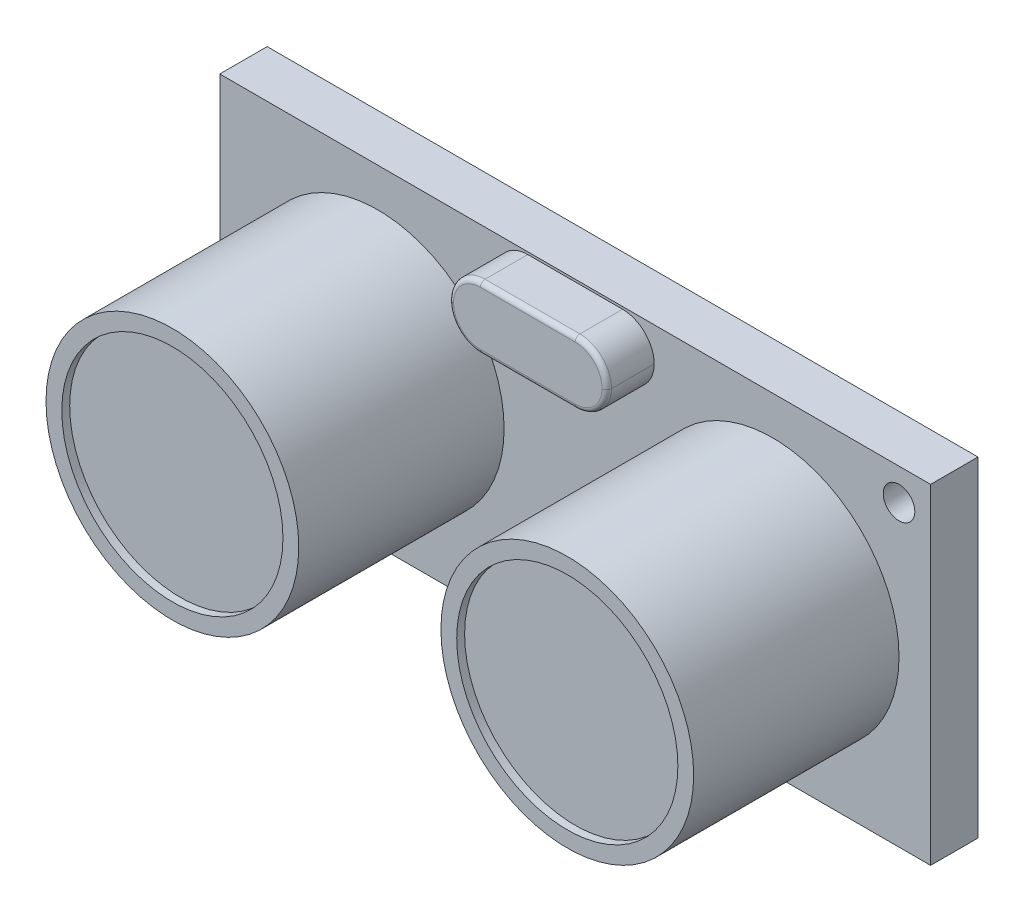
from build123d import *
from build123d.topology import SkipClean

# Parameters (mm, degrees)
SKETCH1_W                = 45
SKETCH1_H                = 20.89
SKETCH1_R                = 1
BOSS_EXTRUDE1_DEPTH      = 3
SKETCH2_R                = 8
BOSS_EXTRUDE2_DEPTH      = 13
SKETCH3_R                = 7
CUT_EXTRUDE1_DEPTH       = 0.5
EXTRUDE_THIN4_DEPTH      = 0.1
EXTRUDE_THIN4_DEPTH_BACK = 3.1
SKETCH4_R                = 1
SKETCH4_R_2              = 0.5
SKETCH13_R               = 0.5
CUT_EXTRUDE2_DEPTH       = 29.006214043
BOSS_EXTRUDE3_DEPTH      = 0.1
SKETCH15_W               = 10
SKETCH15_H               = 4
BOSS_EXTRUDE4_DEPTH      = 3
FILLET1_R                = 2
FILLET2_R                = 0.3


with BuildPart() as part:
    # Sketch1 → Boss-Extrude1 (new body)
    with BuildSketch(Plane.XY):
        Rectangle(SKETCH1_W, SKETCH1_H)
        with Locations((-20.5, -8.445)):
            Circle(SKETCH1_R, mode=Mode.SUBTRACT)
        with Locations((20.5, 8.445)):
            Circle(SKETCH1_R, mode=Mode.SUBTRACT)
    extrude(amount=BOSS_EXTRUDE1_DEPTH)

    # Sketch2 → Boss-Extrude2 (add)
    with BuildSketch(Plane.XY.offset(3)):
        with Locations(Location((-12.5, 0, 0), (0, 0, 180))):
            Circle(SKETCH2_R)
        with Locations(Location((12.5, 0, 0), (0, 0, 180))):
            Circle(SKETCH2_R)
    extrude(amount=BOSS_EXTRUDE2_DEPTH)

    # Sketch3 → Cut-Extrude1 (cut)
    with BuildSketch(Plane.XY.offset(16)):
        with Locations((-12.5, 0)):
            Circle(SKETCH3_R)
        with Locations((12.5, 0)):
            Circle(SKETCH3_R)
    extrude(amount=-CUT_EXTRUDE1_DEPTH, mode=Mode.SUBTRACT)

    # Sketch4 → Extrude-Thin4 (add, two sides: drawn at the far end of the back side and taken through both)
    # profile 1 of 5: a face of its own
    with BuildSketch(Plane.XY.offset(3).offset(-EXTRUDE_THIN4_DEPTH_BACK)):
        with Locations((-5.08, -8.406)):
            Circle(SKETCH4_R)
        with Locations((-5.08, -8.406)):
            Circle(SKETCH4_R_2, mode=Mode.SUBTRACT)
    # profile 2 of 5: a face of its own
    with BuildSketch(Plane.XY.offset(3).offset(-EXTRUDE_THIN4_DEPTH_BACK)):
        with Locations((-2.54, -8.406)):
            Circle(SKETCH4_R)
        with Locations((-2.54, -8.406)):
            Circle(SKETCH4_R_2, mode=Mode.SUBTRACT)
    # profile 3 of 5: a face of its own
    with BuildSketch(Plane.XY.offset(3).offset(-EXTRUDE_THIN4_DEPTH_BACK)):
        with Locations((0, -8.406)):
            Circle(SKETCH4_R)
        with Locations((0, -8.406)):
            Circle(SKETCH4_R_2, mode=Mode.SUBTRACT)
    # profile 4 of 5: a face of its own
    with BuildSketch(Plane.XY.offset(3).offset(-EXTRUDE_THIN4_DEPTH_BACK)):
        with Locations((2.54, -8.406)):
            Circle(SKETCH4_R)
        with Locations((2.54, -8.406)):
            Circle(SKETCH4_R_2, mode=Mode.SUBTRACT)
    # profile 5 of 5: a face of its own
    with BuildSketch(Plane.XY.offset(3).offset(-EXTRUDE_THIN4_DEPTH_BACK)):
        with Locations((5.08, -8.406)):
            Circle(SKETCH4_R)
        with Locations((5.08, -8.406)):
            Circle(SKETCH4_R_2, mode=Mode.SUBTRACT)
    extrude(amount=EXTRUDE_THIN4_DEPTH + EXTRUDE_THIN4_DEPTH_BACK)

    # Sketch13 → Cut-Extrude2 (cut, through all)
    with SkipClean():  # the faces are left unmerged after this step: merging them gives an invalid solid
        with BuildSketch(Plane.XY.offset(3)):
            with Locations((-5.08, -8.406)):
                Circle(SKETCH13_R)
            with Locations((-2.54, -8.406)):
                Circle(SKETCH13_R)
            with Locations(Location((0, -8.406, 0), (0, 0, 180))):
                Circle(SKETCH13_R)
            with Locations(Location((2.54, -8.406, 0), (0, 0, 180))):
                Circle(SKETCH13_R)
            with Locations(Location((5.08, -8.406, 0), (0, 0, 180))):
                Circle(SKETCH13_R)
        extrude(amount=-CUT_EXTRUDE2_DEPTH, mode=Mode.SUBTRACT)

    # Sketch12 → Boss-Extrude3 (add)
    # profile 1 of 5: a face of its own
    with SkipClean():  # the faces are left unmerged after this step: merging them gives an invalid solid
        with BuildSketch(Plane(origin=(0, 0, 0), x_dir=(-1, 0, 0), z_dir=(0, 0, -1))):
            with BuildLine():
                add(Edge.make_bspline(
                    [(19.46929145, -2.683893026), (19.484417806, -2.684223579), (19.51433311, -2.684877312), (19.55857677, -2.689412347), (19.601609877, -2.696623598), (19.643529262, -2.706555749), (19.684115837, -2.719918963), (19.723610749, -2.736127809), (19.762201128, -2.75474264), (19.799136653, -2.77713075), (19.834715807, -2.80169308), (19.86828259, -2.829333068), (19.900019773, -2.859416979), (19.929842776, -2.892296508), (19.95696226, -2.928352739), (19.982882923, -2.966466663), (20.006501357, -3.007561369), (20.028166536, -3.051214815), (20.047339104, -3.097375117), (20.064173328, -3.145621658), (20.078768602, -3.195935133), (20.090261272, -3.24837133), (20.099075501, -3.302915202), (20.10540034, -3.359565322), (20.109601073, -3.418341945), (20.109976956, -3.458260498), (20.110167222, -3.478466619)],
                    knots=[0, 0, 0, 0, 0.949010564, 1.876852617, 2.787529374, 3.685273709, 4.577074086, 5.465471387, 6.362587764, 7.262213343, 8.172580635, 9.073145362, 9.987411958, 10.914456489, 11.85451744, 12.815917507, 13.804911429, 14.825868585, 15.871774033, 16.938849417, 18.030625794, 19.156736427, 20.304747212, 21.4957645, 22.732396811, 24, 24, 24, 24], degree=3))
                add(Edge.make_bspline(
                    [(20.110167222, -3.478466619), (20.109713592, -3.502551257), (20.108822914, -3.54984022), (20.103860332, -3.619166231), (20.094377913, -3.685161229), (20.082197449, -3.748129578), (20.065811319, -3.807833441), (20.045507132, -3.864154145), (20.022642346, -3.91766615), (20.003613894, -3.950828686), (19.994191581, -3.967249769)],
                    knots=[0, 0, 0, 0, 1.136969792, 2.232382444, 3.278022597, 4.282276305, 5.258039159, 6.196692155, 7.1070566, 8, 8, 8, 8], degree=3))
                add(Edge.make_bspline(
                    [(19.994191581, -3.967249769), (19.980125855, -3.988503916), (19.952188373, -4.030719109), (19.900998849, -4.087338382), (19.843562074, -4.138033515), (19.780391, -4.18158225), (19.714579966, -4.217072851), (19.648412339, -4.243220973), (19.582822371, -4.259318087), (19.539200268, -4.261525811), (19.517848725, -4.262606417)],
                    knots=[0, 0, 0, 0, 1.048346287, 2.082235551, 3.132143771, 4.197203545, 5.234784445, 6.204564675, 7.121195205, 8, 8, 8, 8], degree=3))
                add(Edge.make_bspline(
                    [(19.517848725, -4.262606417), (19.505880841, -4.261996217), (19.482506815, -4.260804457), (19.448934686, -4.251239838), (19.418256579, -4.235582628), (19.390595856, -4.214519543), (19.367774744, -4.188124339), (19.351003002, -4.157808329), (19.340409896, -4.124045436), (19.339393406, -4.100293963), (19.338869017, -4.088041007)],
                    knots=[0, 0, 0, 0, 1.029346977, 2.010378973, 2.978887221, 3.98112847, 4.985683985, 5.960201932, 6.947705008, 8, 8, 8, 8], degree=3))
                add(Edge.make_bspline(
                    [(19.338869017, -4.088041007), (19.339245694, -4.078080516), (19.339975706, -4.058776797), (19.348168728, -4.031204492), (19.36058334, -4.005800586), (19.37898544, -3.982970809), (19.401999508, -3.962194269), (19.429956992, -3.943235584), (19.462379414, -3.925486113), (19.486424996, -3.91601565), (19.498987635, -3.911067797)],
                    knots=[0, 0, 0, 0, 0.932019786, 1.806281372, 2.676477655, 3.570524242, 4.53911087, 5.576821434, 6.734007876, 8, 8, 8, 8], degree=3))
                add(Edge.make_bspline(
                    [(19.498987635, -3.911067797), (19.514154901, -3.904497014), (19.543429775, -3.891814514), (19.585067298, -3.871507385), (19.622251922, -3.849696316), (19.656489949, -3.82744116), (19.687800087, -3.802502501), (19.714997365, -3.772135305), (19.740183391, -3.737971347), (19.761936387, -3.698509866), (19.780332925, -3.653726361), (19.792758911, -3.602341133), (19.800986198, -3.544947653), (19.801631627, -3.504449709), (19.80196898, -3.483282216)],
                    knots=[0, 0, 0, 0, 1.049630502, 2.025928848, 2.939419198, 3.785195675, 4.618337008, 5.47201057, 6.365697361, 7.308725407, 8.32613671, 9.430404736, 10.656922266, 12, 12, 12, 12], degree=3))
                add(Edge.make_bspline(
                    [(19.80196898, -3.483282216), (19.801786665, -3.468289639), (19.801429478, -3.438916536), (19.797209523, -3.39604058), (19.790984576, -3.355224522), (19.781715623, -3.316744761), (19.770034495, -3.280393465), (19.756022784, -3.246070232), (19.739234454, -3.213860117), (19.719531242, -3.184397308), (19.698330902, -3.157558433), (19.676051651, -3.13356403), (19.651734729, -3.113808265), (19.626201925, -3.097691901), (19.599724219, -3.084476637), (19.571616619, -3.075919648), (19.542461561, -3.069773451), (19.522430697, -3.06935428), (19.512230528, -3.069140828)],
                    knots=[0, 0, 0, 0, 1.280312405, 2.508357684, 3.676903495, 4.804965861, 5.885491899, 6.935930188, 7.96843881, 8.982636488, 9.958848435, 10.888398438, 11.773624114, 12.626391924, 13.464564268, 14.292153698, 15.130326042, 16, 16, 16, 16], degree=3))
                add(Edge.make_bspline(
                    [(19.512230528, -3.069140828), (19.496494601, -3.069862799), (19.466161185, -3.071254509), (19.423077099, -3.083358943), (19.384333744, -3.102661617), (19.351407073, -3.130916015), (19.322475421, -3.164394049), (19.297717898, -3.203046341), (19.27585837, -3.245712555), (19.257854232, -3.293840184), (19.241563213, -3.348197534), (19.224705921, -3.410023046), (19.207664422, -3.480218562), (19.196344494, -3.529818585), (19.190388093, -3.555917479)],
                    knots=[0, 0, 0, 0, 0.888922646, 1.713534847, 2.512522705, 3.3189352, 4.1507089, 5.009465297, 5.910012526, 6.858957344, 7.912524916, 9.120887575, 10.485048098, 12, 12, 12, 12], degree=3))
                add(Edge.make_bspline(
                    [(19.190388093, -3.555917479), (19.181929691, -3.590087259), (19.165660619, -3.655810153), (19.138396278, -3.749704133), (19.107487465, -3.834351038), (19.075996763, -3.911613713), (19.039365433, -3.980627007), (18.996986053, -4.042080143), (18.948115752, -4.095761163), (18.902393794, -4.13442943), (18.86273622, -4.160699668), (18.831410889, -4.178047101), (18.798259358, -4.192636269), (18.763245036, -4.204110897), (18.726634467, -4.213350814), (18.688309172, -4.220246185), (18.648186982, -4.224299229), (18.620819207, -4.224686994), (18.606898192, -4.224884237)],
                    knots=[0, 0, 0, 0, 1.736572963, 3.340162069, 4.820136415, 6.180570834, 7.453029487, 8.666721429, 9.853271306, 11.024342417, 11.610026699, 12.197789198, 12.78876586, 13.39394109, 14.013340947, 14.650211638, 15.313410593, 16, 16, 16, 16], degree=3))
                add(Edge.make_bspline(
                    [(18.606898192, -4.224884237), (18.593504819, -4.224740931), (18.567042485, -4.224457791), (18.527951434, -4.219539845), (18.489840843, -4.213216925), (18.453112282, -4.202724962), (18.417329584, -4.190475928), (18.382581113, -4.175232627), (18.349418394, -4.156536443), (18.317126027, -4.135826985), (18.286692517, -4.111986582), (18.25762662, -4.08581059), (18.230312173, -4.057111963), (18.205669793, -4.025320842), (18.181514952, -3.992245277), (18.160416695, -3.955702998), (18.14091815, -3.91689848), (18.11625726, -3.861474515), (18.091695675, -3.786346212), (18.070365196, -3.689863343), (18.058072069, -3.585795903), (18.056383732, -3.513947159), (18.055512274, -3.47686142)],
                    knots=[0, 0, 0, 0, 0.769461614, 1.520285473, 2.262551752, 2.988378485, 3.713226575, 4.436358852, 5.166208618, 5.900059362, 6.640050888, 7.38609301, 8.147789305, 8.914131076, 9.697346069, 10.500657756, 11.336485078, 12.193936862, 13.986438256, 15.869279717, 17.867870641, 20, 20, 20, 20], degree=3))
                add(Edge.make_bspline(
                    [(18.055512274, -3.47686142), (18.05600825, -3.447276945), (18.056966469, -3.390120075), (18.065519679, -3.307472284), (18.079250927, -3.231021329), (18.098946205, -3.160799164), (18.123752788, -3.096740742), (18.151543955, -3.038011171), (18.183353447, -2.98499297), (18.218799743, -2.938098441), (18.256208591, -2.896738524), (18.29544728, -2.86187447), (18.334774717, -2.831879), (18.375544801, -2.808851006), (18.416194468, -2.790441669), (18.45663055, -2.777736893), (18.496605537, -2.769471846), (18.523121397, -2.768598858), (18.536269428, -2.768165983)],
                    knots=[0, 0, 0, 0, 1.50180492, 2.901470176, 4.213680385, 5.441471803, 6.598163128, 7.697894763, 8.73692932, 9.731292389, 10.678417777, 11.563424905, 12.393422888, 13.184490135, 13.9355001, 14.655109254, 15.333128709, 16, 16, 16, 16], degree=3))
                add(Edge.make_bspline(
                    [(18.536269428, -2.768165983), (18.547968876, -2.768793298), (18.571072832, -2.770032115), (18.604767094, -2.779696382), (18.636323295, -2.79565456), (18.665371842, -2.817096846), (18.690072435, -2.843185233), (18.708902898, -2.872979724), (18.719626181, -2.906578955), (18.72097737, -2.929949853), (18.721669933, -2.941928794)],
                    knots=[0, 0, 0, 0, 0.996524447, 1.967926831, 2.962621832, 3.998325838, 5.031199617, 6.009342139, 6.979672482, 8, 8, 8, 8], degree=3))
                add(Edge.make_bspline(
                    [(18.721669933, -2.941928794), (18.721237923, -2.952509599), (18.720422718, -2.97247568), (18.71565128, -3.000753797), (18.705808035, -3.024736317), (18.692326163, -3.045597334), (18.674096087, -3.06379414), (18.652013526, -3.082466258), (18.625325748, -3.101924205), (18.605379739, -3.114352949), (18.594859198, -3.120908502)],
                    knots=[0, 0, 0, 0, 1.091037725, 2.058798536, 2.936702634, 3.743333543, 4.601209271, 5.578930148, 6.723004324, 8, 8, 8, 8], degree=3))
                add(Edge.make_bspline(
                    [(18.594859198, -3.120908502), (18.575539247, -3.130312653), (18.538259559, -3.14845886), (18.487226134, -3.180663145), (18.443363111, -3.216252044), (18.411121732, -3.248091479), (18.388932809, -3.276172478), (18.375392396, -3.300675856), (18.36395225, -3.327916675), (18.354092471, -3.357915788), (18.347112663, -3.391039717), (18.341977684, -3.42710389), (18.338748427, -3.466102827), (18.338272979, -3.493040834), (18.338027329, -3.506958904)],
                    knots=[0, 0, 0, 0, 1.547925219, 2.986869477, 4.337480217, 5.612327564, 6.244828973, 6.909713596, 7.622436063, 8.372459485, 9.181850378, 10.058552105, 10.996911345, 12, 12, 12, 12], degree=3))
                add(Edge.make_bspline(
                    [(18.338027329, -3.506958904), (18.338865045, -3.532558407), (18.340463722, -3.581411873), (18.352743768, -3.651016511), (18.374037305, -3.712842943), (18.398984211, -3.758442548), (18.422788372, -3.789499691), (18.44081972, -3.810017039), (18.460169787, -3.826920103), (18.480431517, -3.840723538), (18.501450251, -3.851609225), (18.523287707, -3.860004514), (18.546272099, -3.86424575), (18.561805072, -3.864961487), (18.569577311, -3.865319621)],
                    knots=[0, 0, 0, 0, 1.953936482, 3.728844638, 5.372901677, 6.927342473, 7.670868145, 8.357884895, 9.009286022, 9.626820382, 10.225224998, 10.813344112, 11.406232554, 12, 12, 12, 12], degree=3))
                add(Edge.make_bspline(
                    [(18.569577311, -3.865319621), (18.579113211, -3.864980933), (18.597877953, -3.864314463), (18.624868169, -3.857681525), (18.649829947, -3.847135242), (18.67264924, -3.832338988), (18.693462973, -3.81368373), (18.712613766, -3.79174254), (18.73098022, -3.767342768), (18.751816257, -3.730051612), (18.774805884, -3.681539116), (18.791979424, -3.629173216), (18.805454941, -3.582429304), (18.816688397, -3.537433055), (18.831039039, -3.483002716), (18.840542262, -3.443308216), (18.845671569, -3.421883348)],
                    knots=[0, 0, 0, 0, 0.710597064, 1.398312741, 2.060329599, 2.724976052, 3.418105476, 4.139422309, 4.896209246, 5.692466705, 7.322744487, 8.895039973, 9.798770174, 10.953818098, 12.355841563, 14, 14, 14, 14], degree=3))
                add(Edge.make_bspline(
                    [(18.845671569, -3.421883348), (18.852243438, -3.39456596), (18.865099634, -3.341126413), (18.885959774, -3.263074468), (18.907992459, -3.189099277), (18.93074843, -3.118931762), (18.955043623, -3.053188778), (18.983131163, -2.992870483), (19.012545732, -2.937168657), (19.045060109, -2.886506913), (19.081514481, -2.841201333), (19.121641686, -2.800461623), (19.167070347, -2.766064391), (19.216582316, -2.736142614), (19.271527657, -2.71228591), (19.332434707, -2.695591819), (19.3989918, -2.685475813), (19.445309679, -2.684432972), (19.46929145, -2.683893026)],
                    knots=[0, 0, 0, 0, 1.267425996, 2.479397737, 3.644026965, 4.748891262, 5.806868875, 6.803181051, 7.748078724, 8.646880768, 9.513885508, 10.367259778, 11.219353025, 12.077259478, 12.971817986, 13.911770136, 14.918787934, 16, 16, 16, 16], degree=3))
            make_face()
        # profile 2 of 5: a face of its own
        with BuildSketch(Plane(origin=(0, 0, 0), x_dir=(-1, 0, 0), z_dir=(0, 0, -1))):
            with BuildLine():
                Line((19.236938869, -1.800230878), (19.236938869, -1.939080607))
                Line((19.236938869, -1.939080607), (19.867782146, -1.939080607))
                add(Edge.make_bspline(
                    [(19.867782146, -1.939080607), (19.887227731, -1.939569463), (19.923611489, -1.940484139), (19.974280577, -1.950401281), (20.017014821, -1.967090735), (20.051586482, -1.990674356), (20.077777649, -2.01990028), (20.096740238, -2.053243428), (20.108349006, -2.090822708), (20.10955054, -2.117308302), (20.110167222, -2.130901909)],
                    knots=[0, 0, 0, 0, 1.331902197, 2.492062242, 3.520752585, 4.456973203, 5.333663409, 6.188000262, 7.069999586, 8, 8, 8, 8], degree=3))
                add(Edge.make_bspline(
                    [(20.110167222, -2.130901909), (20.109373291, -2.145409776), (20.107847372, -2.173293636), (20.09683532, -2.212967924), (20.076205729, -2.24664497), (20.048918398, -2.275511003), (20.013410064, -2.297766017), (19.970726045, -2.313122177), (19.921183627, -2.322818647), (19.88575683, -2.3238054), (19.866979546, -2.32432841)],
                    knots=[0, 0, 0, 0, 0.98758274, 1.898116353, 2.767902367, 3.650180778, 4.579683533, 5.591031871, 6.723173417, 8, 8, 8, 8], degree=3))
                Line((19.866979546, -2.32432841), (18.351270222, -2.32432841))
                add(Edge.make_bspline(
                    [(18.351270222, -2.32432841), (18.331280944, -2.323740288), (18.293773724, -2.322636755), (18.24188352, -2.311937018), (18.198309786, -2.294538775), (18.163257167, -2.268807182), (18.137095477, -2.234173002), (18.11923, -2.191152639), (18.108558909, -2.139709432), (18.107464294, -2.102600256), (18.106878648, -2.082745934)],
                    knots=[0, 0, 0, 0, 1.204539147, 2.260157444, 3.178834964, 4.014831347, 4.849268471, 5.763683293, 6.803515522, 8, 8, 8, 8], degree=3))
                Line((18.106878648, -2.082745934), (18.106878648, -1.442271461))
                add(Edge.make_bspline(
                    [(18.106878648, -1.442271461), (18.107059476, -1.42100132), (18.107407569, -1.380056515), (18.109303723, -1.320900151), (18.112849589, -1.266553391), (18.117921188, -1.216426566), (18.125407338, -1.169982505), (18.136034656, -1.126315058), (18.148886368, -1.084761869), (18.160527911, -1.058662721), (18.166271017, -1.045787265)],
                    knots=[0, 0, 0, 0, 1.263018195, 2.431297115, 3.513891869, 4.496307935, 5.422122339, 6.30446181, 7.163542459, 8, 8, 8, 8], degree=3))
                add(Edge.make_bspline(
                    [(18.166271017, -1.045787265), (18.173186513, -1.030381203), (18.186937288, -0.999747782), (18.213068639, -0.956540312), (18.243033035, -0.915964655), (18.27740064, -0.878682035), (18.314738259, -0.844403579), (18.35614933, -0.815189152), (18.399953527, -0.789676869), (18.44667819, -0.768825651), (18.495523638, -0.752581195), (18.54592107, -0.740211327), (18.597885926, -0.73347835), (18.632965113, -0.732475909), (18.650639869, -0.731970825)],
                    knots=[0, 0, 0, 0, 0.991101386, 1.970706541, 2.959125982, 3.949043219, 4.94477413, 5.930285116, 6.919453739, 7.918248778, 8.929482208, 9.939493973, 10.961807665, 12, 12, 12, 12], degree=3))
                add(Edge.make_bspline(
                    [(18.650639869, -0.731970825), (18.668583461, -0.73232809), (18.703639593, -0.733026073), (18.754754471, -0.73928432), (18.803248931, -0.748815301), (18.849139587, -0.762180424), (18.891914834, -0.780678697), (18.932132977, -0.802137642), (18.96957958, -0.827786237), (19.004173954, -0.857528021), (19.035791681, -0.89170093), (19.065916222, -0.928992469), (19.092585043, -0.97108369), (19.11714069, -1.016954235), (19.139142453, -1.067082964), (19.159163306, -1.121022773), (19.176521958, -1.179220962), (19.185676642, -1.219624181), (19.190388093, -1.240417665)],
                    knots=[0, 0, 0, 0, 1.05507517, 2.061284822, 3.02416977, 3.960190338, 4.866266322, 5.760478336, 6.637811303, 7.530498893, 8.437803919, 9.372931164, 10.346335214, 11.363650695, 12.430976955, 13.56370004, 14.746160234, 16, 16, 16, 16], degree=3))
                add(Edge.make_bspline(
                    [(19.190388093, -1.240417665), (19.200427827, -1.222376106), (19.220899361, -1.185588436), (19.259959389, -1.133796289), (19.304747277, -1.08278582), (19.356254388, -1.033986697), (19.411591028, -0.986799902), (19.469225772, -0.941636778), (19.528332151, -0.898760059), (19.588907267, -0.859624919), (19.648670628, -0.823618677), (19.706099342, -0.791258715), (19.760703138, -0.763640398), (19.811402894, -0.740153767), (19.856655487, -0.721449354), (19.894955835, -0.708122709), (19.925318671, -0.699169475), (19.94332506, -0.697397202), (19.950851203, -0.696656443)],
                    knots=[0, 0, 0, 0, 1.035092047, 2.110606056, 3.247378518, 4.439119437, 5.667527541, 6.896357491, 8.113024158, 9.330801598, 10.514364801, 11.614385948, 12.638182879, 13.584379214, 14.418398752, 15.093545921, 15.621128711, 16, 16, 16, 16], degree=3))
                add(Edge.make_bspline(
                    [(19.950851203, -0.696656443), (19.964041869, -0.697988111), (19.991453629, -0.700755473), (20.022873295, -0.717654824), (20.046183068, -0.73517527), (20.062660295, -0.75101425), (20.076500599, -0.769624107), (20.088663848, -0.79012526), (20.098335005, -0.812632242), (20.105021051, -0.837084422), (20.109741287, -0.863148392), (20.110023058, -0.881232034), (20.110167222, -0.890484244)],
                    knots=[0, 0, 0, 0, 1.421053962, 2.95311776, 3.768369014, 4.575895034, 5.411397774, 6.266672613, 7.147343469, 8.048766422, 9.001682164, 10, 10, 10, 10], degree=3))
                add(Edge.make_bspline(
                    [(20.110167222, -0.890484244), (20.109832205, -0.901356962), (20.109185491, -0.922345541), (20.10279153, -0.952381058), (20.093565654, -0.980199809), (20.074127778, -1.012575278), (20.044129385, -1.049196215), (20.006138096, -1.079661725), (19.970415066, -1.103157313), (19.937742869, -1.124120877), (19.899373952, -1.148105272), (19.871683967, -1.164876217), (19.856947051, -1.173801899)],
                    knots=[0, 0, 0, 0, 0.812054064, 1.56758039, 2.289145878, 2.992867892, 4.379130512, 5.807652158, 6.615255223, 7.578411575, 8.711203985, 10, 10, 10, 10], degree=3))
                Line((19.856947051, -1.173801899), (19.591687887, -1.335124416))
                add(Edge.make_bspline(
                    [(19.591687887, -1.335124416), (19.568712309, -1.348871396), (19.525264039, -1.374867804), (19.465196917, -1.414237897), (19.413821081, -1.45135698), (19.370496318, -1.486425891), (19.334807335, -1.520807514), (19.305094614, -1.55469524), (19.282105713, -1.589560527), (19.264098857, -1.62500043), (19.25142667, -1.663012017), (19.243523551, -1.704868082), (19.237482435, -1.750965884), (19.237125087, -1.783353374), (19.236938869, -1.800230878)],
                    knots=[0, 0, 0, 0, 1.549240544, 2.929711722, 4.154429701, 5.215920692, 6.152032193, 7.019334908, 7.817977517, 8.562251951, 9.313736963, 10.127430344, 11.024181782, 12, 12, 12, 12], degree=3))
            make_face()
            with BuildLine():
                Line((18.41507689, -1.573095194), (18.41507689, -1.939080607))
                Line((18.41507689, -1.939080607), (18.954423814, -1.939080607))
                Line((18.954423814, -1.939080607), (18.954423814, -1.583930289))
                add(Edge.make_bspline(
                    [(18.954423814, -1.583930289), (18.954079771, -1.561052235), (18.95341716, -1.516990022), (18.949415073, -1.453810733), (18.941134359, -1.396364754), (18.930772368, -1.34454499), (18.916521718, -1.298160403), (18.897635038, -1.257536318), (18.874321584, -1.222486007), (18.846171277, -1.193339399), (18.812927068, -1.170191533), (18.773918643, -1.154204272), (18.729500531, -1.144486988), (18.698046819, -1.143447393), (18.681539953, -1.142901815)],
                    knots=[0, 0, 0, 0, 1.392674693, 2.682235545, 3.849820756, 4.922907172, 5.896284646, 6.795937237, 7.640517491, 8.44662346, 9.24840026, 10.087665541, 10.996409465, 12, 12, 12, 12], degree=3))
                add(Edge.make_bspline(
                    [(18.681539953, -1.142901815), (18.668249815, -1.143268512), (18.642212955, -1.143986913), (18.604681271, -1.152433954), (18.569452481, -1.16532031), (18.537115649, -1.183502086), (18.507412206, -1.205750853), (18.482699331, -1.233431705), (18.460183411, -1.263853075), (18.44971231, -1.287133705), (18.444371775, -1.299007435)],
                    knots=[0, 0, 0, 0, 1.054707271, 2.066288818, 3.042079463, 4.027441999, 5.005836686, 5.976573042, 6.967999406, 8, 8, 8, 8], degree=3))
                add(Edge.make_bspline(
                    [(18.444371775, -1.299007435), (18.441988909, -1.305526806), (18.436809149, -1.319698305), (18.430881077, -1.343610178), (18.426457055, -1.371717154), (18.421820998, -1.403777985), (18.418718916, -1.440083634), (18.417027438, -1.480653587), (18.415124285, -1.525457961), (18.415093129, -1.556773176), (18.41507689, -1.573095194)],
                    knots=[0, 0, 0, 0, 0.601274756, 1.307022564, 2.130372336, 3.066540635, 4.11402688, 5.286356465, 6.585603249, 8, 8, 8, 8], degree=3))
            make_face(mode=Mode.SUBTRACT)
        # profile 3 of 5: a face of its own
        with BuildSketch(Plane(origin=(0, 0, 0), x_dir=(-1, 0, 0), z_dir=(0, 0, -1))):
            with BuildLine():
                Line((18.41507689, 0.831091874), (18.41507689, 0.03852478))
                Line((18.41507689, 0.03852478), (18.90305744, 0.03852478))
                Line((18.90305744, 0.03852478), (18.90305744, 0.701070741))
                add(Edge.make_bspline(
                    [(18.90305744, 0.701070741), (18.903613439, 0.715413667), (18.904661621, 0.742453239), (18.911903609, 0.780369065), (18.925277155, 0.812518682), (18.943900572, 0.838849766), (18.967510759, 0.858807873), (18.994304088, 0.873595087), (19.02506835, 0.882258308), (19.04666647, 0.883180155), (19.057959161, 0.883662148)],
                    knots=[0, 0, 0, 0, 1.26669481, 2.387998457, 3.388485007, 4.319542635, 5.207485584, 6.095585677, 7.004267047, 8, 8, 8, 8], degree=3))
                add(Edge.make_bspline(
                    [(19.057959161, 0.883662148), (19.069130511, 0.88321293), (19.090655946, 0.882347357), (19.121027017, 0.873143115), (19.147808526, 0.858472273), (19.170645521, 0.837865736), (19.189603068, 0.811861023), (19.202068778, 0.779509499), (19.210356549, 0.742155267), (19.210944216, 0.715302712), (19.211255682, 0.701070741)],
                    knots=[0, 0, 0, 0, 0.989664805, 1.906928296, 2.789763925, 3.681746705, 4.618201249, 5.619917427, 6.738545855, 8, 8, 8, 8], degree=3))
                Line((19.211255682, 0.701070741), (19.211255682, 0.03852478))
                Line((19.211255682, 0.03852478), (19.864973047, 0.03852478))
                add(Edge.make_bspline(
                    [(19.864973047, 0.03852478), (19.884417787, 0.038018097), (19.921062558, 0.037063222), (19.972118122, 0.027229681), (20.0155337, 0.010593866), (20.050380879, -0.013618022), (20.077248594, -0.042893545), (20.096712963, -0.07623171), (20.108341425, -0.113614522), (20.109547944, -0.139837104), (20.110167222, -0.153296522)],
                    knots=[0, 0, 0, 0, 1.324444831, 2.495995325, 3.52738831, 4.471056898, 5.361856607, 6.215950617, 7.08429057, 8, 8, 8, 8], degree=3))
                add(Edge.make_bspline(
                    [(20.110167222, -0.153296522), (20.109605163, -0.167039311), (20.108513617, -0.193728494), (20.096189432, -0.231456844), (20.077015102, -0.265268078), (20.049944741, -0.29453884), (20.015324498, -0.318815862), (19.972223157, -0.334677303), (19.92222676, -0.345509719), (19.886177446, -0.346301411), (19.866979546, -0.346723022)],
                    knots=[0, 0, 0, 0, 0.935929894, 1.817622685, 2.681511336, 3.574268386, 4.520010484, 5.54180128, 6.690897382, 8, 8, 8, 8], degree=3))
                Line((19.866979546, -0.346723022), (18.351270222, -0.346723022))
                add(Edge.make_bspline(
                    [(18.351270222, -0.346723022), (18.337613974, -0.346409172), (18.31156212, -0.345810443), (18.274308319, -0.341478689), (18.240859588, -0.334033398), (18.211201187, -0.323269338), (18.185352027, -0.309076693), (18.163231499, -0.291310698), (18.145502574, -0.269437557), (18.130724475, -0.244671574), (18.120020842, -0.216084928), (18.112619549, -0.184100213), (18.107659661, -0.148632924), (18.107146592, -0.123752337), (18.106878648, -0.110758743)],
                    knots=[0, 0, 0, 0, 1.24824502, 2.381261253, 3.422463234, 4.374230178, 5.255516348, 6.107294269, 6.949627804, 7.815767679, 8.733215993, 9.726798055, 10.812847089, 12, 12, 12, 12], degree=3))
                Line((18.106878648, -0.110758743), (18.106878648, 0.831091874))
                add(Edge.make_bspline(
                    [(18.106878648, 0.831091874), (18.107419374, 0.846105218), (18.108431651, 0.874211211), (18.115756938, 0.913549918), (18.128983591, 0.94682447), (18.147704949, 0.974014748), (18.171111535, 0.994724783), (18.197774958, 1.01008444), (18.228041573, 1.019081164), (18.2492808, 1.020022521), (18.260175169, 1.020505377)],
                    knots=[0, 0, 0, 0, 1.305293606, 2.443597845, 3.460957068, 4.396713591, 5.286368424, 6.156339552, 7.054319707, 8, 8, 8, 8], degree=3))
                add(Edge.make_bspline(
                    [(18.260175169, 1.020505377), (18.271334872, 1.020028052), (18.292966356, 1.019102824), (18.323677153, 1.010177935), (18.350433405, 0.994714209), (18.373878091, 0.974028619), (18.392484118, 0.946733302), (18.406327536, 0.913658099), (18.413481542, 0.874193565), (18.414521419, 0.846099074), (18.41507689, 0.831091874)],
                    knots=[0, 0, 0, 0, 0.964185515, 1.868935361, 2.734709653, 3.620072693, 4.551315024, 5.56819034, 6.701003273, 8, 8, 8, 8], degree=3))
            make_face()
        # profile 4 of 5: a face of its own
        with BuildSketch(Plane(origin=(0, 0, 0), x_dir=(-1, 0, 0), z_dir=(0, 0, -1))):
            with BuildLine():
                add(Edge.make_bspline(
                    [(19.106516436, 2.632526652), (19.141835751, 2.632229246), (19.209967989, 2.631655539), (19.308249757, 2.626997012), (19.398761863, 2.618602882), (19.482253002, 2.607057531), (19.560542405, 2.591720398), (19.634128598, 2.569881976), (19.704417817, 2.543184103), (19.748384706, 2.520578198), (19.770266296, 2.509327615)],
                    knots=[0, 0, 0, 0, 1.24224353, 2.396332709, 3.459542317, 4.438314338, 5.360108057, 6.262326286, 7.135188689, 8, 8, 8, 8], degree=3))
                add(Edge.make_bspline(
                    [(19.770266296, 2.509327615), (19.796238869, 2.493356301), (19.84731425, 2.461948518), (19.915518903, 2.4049938), (19.973914595, 2.340776938), (20.014915562, 2.282067001), (20.042671038, 2.232414747), (20.060896355, 2.194117806), (20.076073961, 2.154782925), (20.088693451, 2.114329505), (20.098197263, 2.072848493), (20.104920753, 2.030337976), (20.109716099, 1.986944655), (20.110015719, 1.957553808), (20.110167222, 1.942692305)],
                    knots=[0, 0, 0, 0, 1.580397239, 3.107870444, 4.591483573, 6.071993126, 6.811458575, 7.540989501, 8.270454403, 8.997041459, 9.737775931, 10.475970176, 11.229373204, 12, 12, 12, 12], degree=3))
                add(Edge.make_bspline(
                    [(20.110167222, 1.942692305), (20.109718196, 1.925559498), (20.108832126, 1.891751038), (20.103695385, 1.841654894), (20.094349905, 1.79312107), (20.081613702, 1.745786103), (20.06442702, 1.700104779), (20.044636251, 1.655282106), (20.020197098, 1.612285153), (19.992671858, 1.570639979), (19.961742497, 1.530994432), (19.928087771, 1.493560555), (19.89131671, 1.458963723), (19.851884325, 1.426791904), (19.809563419, 1.396930283), (19.764310686, 1.369821714), (19.716326927, 1.345111161), (19.682882324, 1.331027441), (19.665928349, 1.323888022)],
                    knots=[0, 0, 0, 0, 1.013654932, 2.000262503, 2.974897205, 3.934739091, 4.89611284, 5.859471119, 6.830211065, 7.817833599, 8.810294581, 9.80196658, 10.792754173, 11.793821649, 12.810314228, 13.853919655, 14.912093751, 16, 16, 16, 16], degree=3))
                add(Edge.make_bspline(
                    [(19.665928349, 1.323888022), (19.647007278, 1.317362039), (19.608570638, 1.304105029), (19.548417049, 1.288361527), (19.485529948, 1.274586148), (19.419582491, 1.263994583), (19.350935851, 1.255380462), (19.279537018, 1.250156534), (19.205413136, 1.246244083), (19.155079376, 1.245840526), (19.129390524, 1.245634562)],
                    knots=[0, 0, 0, 0, 0.881300005, 1.790290336, 2.736775026, 3.716068374, 4.731167005, 5.783179305, 6.86860072, 8, 8, 8, 8], degree=3))
                add(Edge.make_bspline(
                    [(19.129390524, 1.245634562), (19.096478877, 1.24581142), (19.032368438, 1.246155933), (18.938700156, 1.250395995), (18.850071591, 1.256551884), (18.766655823, 1.265702143), (18.688568653, 1.277654723), (18.616097279, 1.292412755), (18.549010143, 1.309616833), (18.507144394, 1.324648709), (18.486909553, 1.331914018)],
                    knots=[0, 0, 0, 0, 1.212279312, 2.361466649, 3.453316133, 4.484503641, 5.451820176, 6.362159784, 7.208387816, 8, 8, 8, 8], degree=3))
                add(Edge.make_bspline(
                    [(18.486909553, 1.331914018), (18.470762432, 1.338797397), (18.439090545, 1.35229885), (18.393905476, 1.375770783), (18.351605985, 1.401428877), (18.312314366, 1.429638291), (18.275545254, 1.459621046), (18.242124048, 1.49238498), (18.211643121, 1.527246128), (18.184075597, 1.564314197), (18.160261953, 1.603782107), (18.138751625, 1.644597846), (18.120956434, 1.68760281), (18.106794002, 1.732538064), (18.094866717, 1.779084947), (18.08704658, 1.827573387), (18.082066536, 1.877843888), (18.081489197, 1.912047461), (18.081195461, 1.929449412)],
                    knots=[0, 0, 0, 0, 1.091111206, 2.140167975, 3.162946158, 4.164640209, 5.145466981, 6.110078272, 7.070916974, 8.022458711, 8.978207941, 9.93428284, 10.888873235, 11.867369661, 12.861889973, 13.873753768, 14.918217287, 16, 16, 16, 16], degree=3))
                add(Edge.make_bspline(
                    [(18.081195461, 1.929449412), (18.081723841, 1.95221394), (18.08275952, 1.99683471), (18.091218762, 2.062204185), (18.10583724, 2.124195221), (18.125387812, 2.183190919), (18.150790744, 2.238690583), (18.181388382, 2.290787594), (18.217460233, 2.339211537), (18.258478864, 2.38436989), (18.305210684, 2.425912391), (18.356731361, 2.464235634), (18.413602923, 2.49918336), (18.454096894, 2.51914973), (18.474870559, 2.529392605)],
                    knots=[0, 0, 0, 0, 1.074291325, 2.105719259, 3.104291516, 4.076669601, 5.034507252, 5.979860306, 6.923186968, 7.879670961, 8.854444549, 9.869744472, 10.907165378, 12, 12, 12, 12], degree=3))
                add(Edge.make_bspline(
                    [(18.474870559, 2.529392605), (18.494274321, 2.537752753), (18.534475983, 2.555073718), (18.599412009, 2.575284139), (18.669748181, 2.593668212), (18.745981047, 2.607674679), (18.827921243, 2.618995107), (18.915642296, 2.626780271), (19.009211874, 2.631677728), (19.073469623, 2.632238338), (19.106516436, 2.632526652)],
                    knots=[0, 0, 0, 0, 0.786151885, 1.628787956, 2.528718292, 3.491837123, 4.512437559, 5.607691779, 6.769671193, 8, 8, 8, 8], degree=3))
            make_face()
            with BuildLine():
                add(Edge.make_bspline(
                    [(19.079629349, 2.272962036), (19.059696796, 2.27292552), (19.020761012, 2.27285419), (18.963770403, 2.271119664), (18.909457568, 2.268706556), (18.857917259, 2.265723448), (18.809109524, 2.261095884), (18.763157111, 2.256178964), (18.719979547, 2.249536306), (18.667478266, 2.240450974), (18.607712381, 2.225851541), (18.543220143, 2.20308724), (18.48859093, 2.173999166), (18.449507112, 2.145591622), (18.424452393, 2.119130012), (18.407853958, 2.098402936), (18.393978671, 2.075662432), (18.383278075, 2.050817014), (18.374487988, 2.024516972), (18.367893165, 1.996476021), (18.364382389, 1.96659381), (18.363938817, 1.946045064), (18.363710516, 1.935468909)],
                    knots=[0, 0, 0, 0, 1.347647352, 2.632462932, 3.854663529, 5.023633764, 6.122520203, 7.169251864, 8.147763337, 9.075642165, 10.771294062, 12.302045326, 13.685839966, 14.944833451, 15.546133651, 16.145048405, 16.737578031, 17.340915391, 17.970135936, 18.610758548, 19.284976654, 20, 20, 20, 20], degree=3))
                add(Edge.make_bspline(
                    [(18.363710516, 1.935468909), (18.364192231, 1.920571457), (18.365124992, 1.891725042), (18.373978349, 1.85030237), (18.38730497, 1.811959373), (18.407436578, 1.777584114), (18.432609229, 1.746561269), (18.463620675, 1.719445005), (18.500299644, 1.696182912), (18.542466521, 1.675985409), (18.590624731, 1.659655884), (18.644281719, 1.644595282), (18.703994544, 1.632458566), (18.769778441, 1.622552916), (18.841391229, 1.614569266), (18.919168931, 1.609042924), (19.002821843, 1.605950238), (19.060631927, 1.60545483), (19.090464444, 1.605199178)],
                    knots=[0, 0, 0, 0, 0.800712426, 1.5504452, 2.270089568, 2.976430944, 3.68255215, 4.411961279, 5.182793406, 6.01355921, 6.922072822, 7.915944648, 9.011614588, 10.198826553, 11.495524534, 12.888644882, 14.39440548, 16, 16, 16, 16], degree=3))
                add(Edge.make_bspline(
                    [(19.090464444, 1.605199178), (19.110932047, 1.605235546), (19.150937738, 1.605306631), (19.20953304, 1.607046425), (19.265318486, 1.609439052), (19.318326037, 1.612464562), (19.368476214, 1.617041909), (19.415761158, 1.621990873), (19.460144471, 1.628626051), (19.514234474, 1.637735082), (19.575762032, 1.652193043), (19.64206719, 1.675095787), (19.69827873, 1.704165433), (19.738723218, 1.732537503), (19.764738151, 1.758881379), (19.782047496, 1.779363482), (19.795956602, 1.802112464), (19.807690286, 1.82611383), (19.81660243, 1.851871007), (19.822885677, 1.879181091), (19.827116195, 1.908183521), (19.827470833, 1.928096222), (19.827652166, 1.938278008)],
                    knots=[0, 0, 0, 0, 1.360892793, 2.659982061, 3.897473583, 5.073706367, 6.189819789, 7.245725, 8.234419589, 9.173203856, 10.892611866, 12.431469099, 13.823825965, 15.090508813, 15.694289814, 16.281935201, 16.869311273, 17.462050397, 18.055589799, 18.676935243, 19.323488959, 20, 20, 20, 20], degree=3))
                add(Edge.make_bspline(
                    [(19.827652166, 1.938278008), (19.827459482, 1.94885691), (19.827084799, 1.969428031), (19.823076503, 1.999320288), (19.815980489, 2.027298693), (19.807168508, 2.053975455), (19.794348351, 2.078281146), (19.779943836, 2.101385361), (19.762022261, 2.122077728), (19.734815917, 2.148329389), (19.693617662, 2.176787199), (19.636475088, 2.205337947), (19.570015243, 2.227952713), (19.508582913, 2.24168281), (19.454797363, 2.250393776), (19.410377564, 2.256473852), (19.362862263, 2.261558762), (19.312170783, 2.26607211), (19.258506704, 2.269258193), (19.201629692, 2.270974914), (19.141709106, 2.272893639), (19.100632508, 2.272938896), (19.079629349, 2.272962036)],
                    knots=[0, 0, 0, 0, 0.693691847, 1.348913083, 1.972464501, 2.585744591, 3.186146807, 3.7702996, 4.368002788, 4.976177112, 6.247129624, 7.632347309, 9.155818429, 10.839487285, 11.755496797, 12.729633812, 13.780021632, 14.889824529, 16.067712469, 17.305706588, 18.622362222, 20, 20, 20, 20], degree=3))
            make_face(mode=Mode.SUBTRACT)
        # profile 5 of 5: a face of its own
        with BuildSketch(Plane(origin=(0, 0, 0), x_dir=(-1, 0, 0), z_dir=(0, 0, -1))):
            with BuildLine():
                Line((18.41507689, 4.052325325), (18.41507689, 3.408640455))
                Line((18.41507689, 3.408640455), (18.858111863, 3.331590894))
                add(Edge.make_bspline(
                    [(18.858111863, 3.331590894), (18.849372161, 3.347416978), (18.83232872, 3.378279694), (18.810301299, 3.425128392), (18.791180191, 3.470806149), (18.776098168, 3.515810941), (18.763708031, 3.559663658), (18.755451, 3.602771566), (18.749823896, 3.64485691), (18.749243379, 3.672678346), (18.748958319, 3.686339912)],
                    knots=[0, 0, 0, 0, 1.156031135, 2.254395925, 3.309385178, 4.321273619, 5.288520282, 6.221443175, 7.12664928, 8, 8, 8, 8], degree=3))
                add(Edge.make_bspline(
                    [(18.748958319, 3.686339912), (18.749600508, 3.707640722), (18.750874786, 3.749907314), (18.760265351, 3.812058908), (18.775697892, 3.872119109), (18.796795396, 3.929746056), (18.82385133, 3.984318175), (18.855490592, 4.035561129), (18.892390055, 4.082624178), (18.933223116, 4.126200608), (18.979003778, 4.165238096), (19.028649006, 4.200166769), (19.082499766, 4.230364357), (19.139784898, 4.256072517), (19.200278086, 4.276420961), (19.263235659, 4.291389899), (19.32857065, 4.300458239), (19.372950592, 4.301437359), (19.395452288, 4.301933797)],
                    knots=[0, 0, 0, 0, 1.026611596, 2.037076288, 3.022413444, 4.011898786, 4.989546235, 5.954025754, 6.909843404, 7.867790456, 8.828122028, 9.804918424, 10.789537881, 11.79981737, 12.827582723, 13.861459599, 14.915708723, 16, 16, 16, 16], degree=3))
                add(Edge.make_bspline(
                    [(19.395452288, 4.301933797), (19.427760845, 4.301000554), (19.491452581, 4.299160798), (19.584540928, 4.282526958), (19.673344131, 4.256153624), (19.743115518, 4.224727502), (19.796031193, 4.195027439), (19.833505069, 4.169956984), (19.868923881, 4.142628055), (19.902292054, 4.11283599), (19.93379586, 4.080629702), (19.962913853, 4.045791009), (19.989948876, 4.008625047), (20.014790425, 3.969371525), (20.037215678, 3.928101777), (20.057080893, 3.885039332), (20.073469972, 3.840048223), (20.086652966, 3.793324917), (20.097070771, 3.745070865), (20.104800343, 3.695108082), (20.109155907, 3.643345), (20.109827056, 3.608228002), (20.110167222, 3.590429262)],
                    knots=[0, 0, 0, 0, 1.711147685, 3.37328478, 4.994949039, 6.610339793, 7.416750561, 8.209202439, 8.997679871, 9.78606167, 10.578228054, 11.383422398, 12.190331681, 13.012514466, 13.843726651, 14.67810767, 15.523709018, 16.378768627, 17.249296324, 18.138703239, 19.056618197, 20, 20, 20, 20], degree=3))
                add(Edge.make_bspline(
                    [(20.110167222, 3.590429262), (20.110029573, 3.570620959), (20.10976134, 3.532021183), (20.104957625, 3.475528244), (20.098416024, 3.421904449), (20.088923802, 3.371014887), (20.075862869, 3.323271736), (20.060882851, 3.278195185), (20.042627602, 3.236101435), (20.015367049, 3.184968357), (19.97737006, 3.127927944), (19.928051276, 3.068075475), (19.875002096, 3.019232253), (19.818791666, 2.982463432), (19.763375376, 2.955233192), (19.710956897, 2.935049363), (19.661819588, 2.922646891), (19.630004461, 2.92075278), (19.614963275, 2.919857305)],
                    knots=[0, 0, 0, 0, 1.032093293, 2.011205585, 2.952964999, 3.847252965, 4.706415705, 5.531020485, 6.32109392, 7.094596524, 8.548774814, 9.885141963, 11.128927262, 12.291106832, 13.373074573, 14.341704631, 15.216010439, 16, 16, 16, 16], degree=3))
                add(Edge.make_bspline(
                    [(19.614963275, 2.919857305), (19.606210548, 2.920433457), (19.588608352, 2.921592128), (19.562731976, 2.930058215), (19.537928092, 2.944245064), (19.514260253, 2.962997428), (19.494033772, 2.986363654), (19.47858252, 3.013046312), (19.469540552, 3.042885546), (19.468578208, 3.063730026), (19.468087551, 3.074357726)],
                    knots=[0, 0, 0, 0, 0.891772366, 1.793401163, 2.746006762, 3.79412415, 4.857924086, 5.878153834, 6.918162393, 8, 8, 8, 8], degree=3))
                add(Edge.make_bspline(
                    [(19.468087551, 3.074357726), (19.468458986, 3.08361867), (19.469183352, 3.101679177), (19.475268649, 3.127847084), (19.486010538, 3.15189885), (19.50068826, 3.174213056), (19.519323785, 3.194825984), (19.54212509, 3.213335038), (19.569003822, 3.229972694), (19.588895456, 3.238986017), (19.599312583, 3.243706239)],
                    knots=[0, 0, 0, 0, 0.971980174, 1.895536086, 2.801396063, 3.724951974, 4.689900168, 5.708100931, 6.799746478, 8, 8, 8, 8], degree=3))
                add(Edge.make_bspline(
                    [(19.599312583, 3.243706239), (19.618605276, 3.252947921), (19.656231428, 3.270971788), (19.706342123, 3.306101341), (19.750693166, 3.344688241), (19.787040057, 3.38871904), (19.816822057, 3.436007575), (19.837697662, 3.486927191), (19.851313901, 3.540358549), (19.85265739, 3.57710356), (19.853335353, 3.595646159)],
                    knots=[0, 0, 0, 0, 1.114388395, 2.173369472, 3.181905356, 4.172949301, 5.141395086, 6.086316069, 7.034299513, 8, 8, 8, 8], degree=3))
                add(Edge.make_bspline(
                    [(19.853335353, 3.595646159), (19.852823796, 3.61256197), (19.851822654, 3.64566697), (19.840895931, 3.693386761), (19.823949337, 3.737974842), (19.800131474, 3.778859097), (19.770506171, 3.815975639), (19.736015029, 3.849272129), (19.695423165, 3.876987169), (19.650592086, 3.900560261), (19.601617798, 3.919494935), (19.549026832, 3.93253509), (19.493361462, 3.940778383), (19.455142016, 3.941830655), (19.435582267, 3.942369181)],
                    knots=[0, 0, 0, 0, 0.999542791, 1.956150026, 2.880941895, 3.813831331, 4.743625034, 5.684375802, 6.639737325, 7.641941603, 8.677003637, 9.738847702, 10.842799317, 12, 12, 12, 12], degree=3))
                add(Edge.make_bspline(
                    [(19.435582267, 3.942369181), (19.414676468, 3.941924173), (19.374401046, 3.941066855), (19.316299573, 3.931840157), (19.262818184, 3.917800449), (19.214337515, 3.897570273), (19.171207667, 3.872680684), (19.133582011, 3.843744443), (19.101582822, 3.810769135), (19.075938787, 3.773769963), (19.056398044, 3.733667052), (19.041564366, 3.691616294), (19.033067487, 3.647086334), (19.032009752, 3.616682262), (19.031473374, 3.601264356)],
                    knots=[0, 0, 0, 0, 1.264307668, 2.435712816, 3.551282472, 4.603813104, 5.605052054, 6.557298982, 7.467737889, 8.37511164, 9.269460386, 10.16050474, 11.067191922, 12, 12, 12, 12], degree=3))
                add(Edge.make_bspline(
                    [(19.031473374, 3.601264356), (19.031628773, 3.583181318), (19.031916326, 3.549720191), (19.03772147, 3.503682886), (19.045706175, 3.465480839), (19.059271863, 3.43370358), (19.078135731, 3.404385076), (19.100499511, 3.371318288), (19.127967926, 3.332434303), (19.159541042, 3.290663784), (19.189767927, 3.247997146), (19.212540417, 3.207222667), (19.227341726, 3.170181789), (19.229520531, 3.146292656), (19.230518072, 3.135355295)],
                    knots=[0, 0, 0, 0, 1.253320121, 2.319162568, 3.215033915, 3.951008832, 4.700606019, 5.629743289, 6.721449385, 8.002092677, 9.263357855, 10.343167053, 11.241438274, 12, 12, 12, 12], degree=3))
                add(Edge.make_bspline(
                    [(19.230518072, 3.135355295), (19.229874574, 3.124456411), (19.228613145, 3.103091687), (19.219280336, 3.07193618), (19.203906581, 3.042885246), (19.18262433, 3.016799516), (19.158027101, 2.994698815), (19.130976942, 2.977985205), (19.101867706, 2.967830534), (19.081712863, 2.966615988), (19.071603354, 2.966006781)],
                    knots=[0, 0, 0, 0, 1.021493999, 2.002401241, 3.024126496, 4.086435777, 5.144287797, 6.112833732, 7.053412325, 8, 8, 8, 8], degree=3))
                add(Edge.make_bspline(
                    [(19.071603354, 2.966006781), (19.068790919, 2.966247304), (19.059906835, 2.967007082), (19.041630388, 2.970270162), (19.013415348, 2.974955147), (18.991209461, 2.97870752), (18.978501801, 2.980854874)],
                    knots=[0, 0, 0, 0, 0.359093097, 1.134324626, 2.360073298, 4, 4, 4, 4], degree=3))
                Line((18.978501801, 2.980854874), (18.321975337, 3.094422716))
                add(Edge.make_bspline(
                    [(18.321975337, 3.094422716), (18.304351772, 3.097885412), (18.271150508, 3.104408831), (18.225763768, 3.119886248), (18.188025222, 3.139696931), (18.156850682, 3.163659733), (18.133064708, 3.195027974), (18.118076223, 3.234349173), (18.108274262, 3.280947768), (18.107366378, 3.31467561), (18.106878648, 3.332794793)],
                    knots=[0, 0, 0, 0, 1.194129083, 2.249635226, 3.177331393, 4.019641834, 4.845571199, 5.759547176, 6.796389752, 8, 8, 8, 8], degree=3))
                Line((18.106878648, 3.332794793), (18.106878648, 4.044299329))
                add(Edge.make_bspline(
                    [(18.106878648, 4.044299329), (18.107284527, 4.060245639), (18.108046585, 4.090185616), (18.115071789, 4.132191378), (18.127314844, 4.167840112), (18.144393195, 4.19754394), (18.166860371, 4.220796847), (18.194920954, 4.23666268), (18.227408985, 4.246622876), (18.25073308, 4.247630409), (18.262984268, 4.248159625)],
                    knots=[0, 0, 0, 0, 1.306773136, 2.453530613, 3.476791313, 4.381515022, 5.242365076, 6.092600397, 6.998121453, 8, 8, 8, 8], degree=3))
                add(Edge.make_bspline(
                    [(18.262984268, 4.248159625), (18.27388415, 4.247548867), (18.295033553, 4.246363794), (18.325140412, 4.236965643), (18.351451876, 4.220704031), (18.37428354, 4.198622855), (18.392891039, 4.170511211), (18.406268197, 4.13624861), (18.413449514, 4.096095313), (18.41451386, 4.067468615), (18.41507689, 4.052325325)],
                    knots=[0, 0, 0, 0, 0.934297721, 1.812848832, 2.673138209, 3.566118365, 4.518019535, 5.543292166, 6.700421607, 8, 8, 8, 8], degree=3))
            make_face()
        extrude(amount=BOSS_EXTRUDE3_DEPTH)

    # Sketch15 → Boss-Extrude4 (add)
    with SkipClean():  # the faces are left unmerged after this step: merging them gives an invalid solid
        with BuildSketch(Plane.XY.offset(3)):
            with Locations((0, 8.295)):
                Rectangle(SKETCH15_W, SKETCH15_H)
        extrude(amount=BOSS_EXTRUDE4_DEPTH)

    # Fillet1
    fillet1_edges = [part.edges().sort_by_distance(p)[0] for p in [
        (5, 10.295, 4.5),
        (5, 6.295, 4.5),
        (-5, 6.295, 4.5),
        (-5, 10.295, 4.5),
    ]]
    fillet(fillet1_edges, radius=FILLET1_R - 0.0001)  # a hair under: the kernel refuses the full size

    # Fillet2
    fillet2_edges = [part.edges().sort_by_distance(p)[0] for p in [
        (0, 10.295, 6),
        (0, 6.295, 6),
        (-4.414242852, 9.709242852, 6),
        (-4.414242852, 6.880757148, 6),
        (4.414242852, 6.880757148, 6),
        (4.414242852, 9.709242852, 6),
    ]]
    fillet(fillet2_edges, radius=FILLET2_R)


solid = part.part
